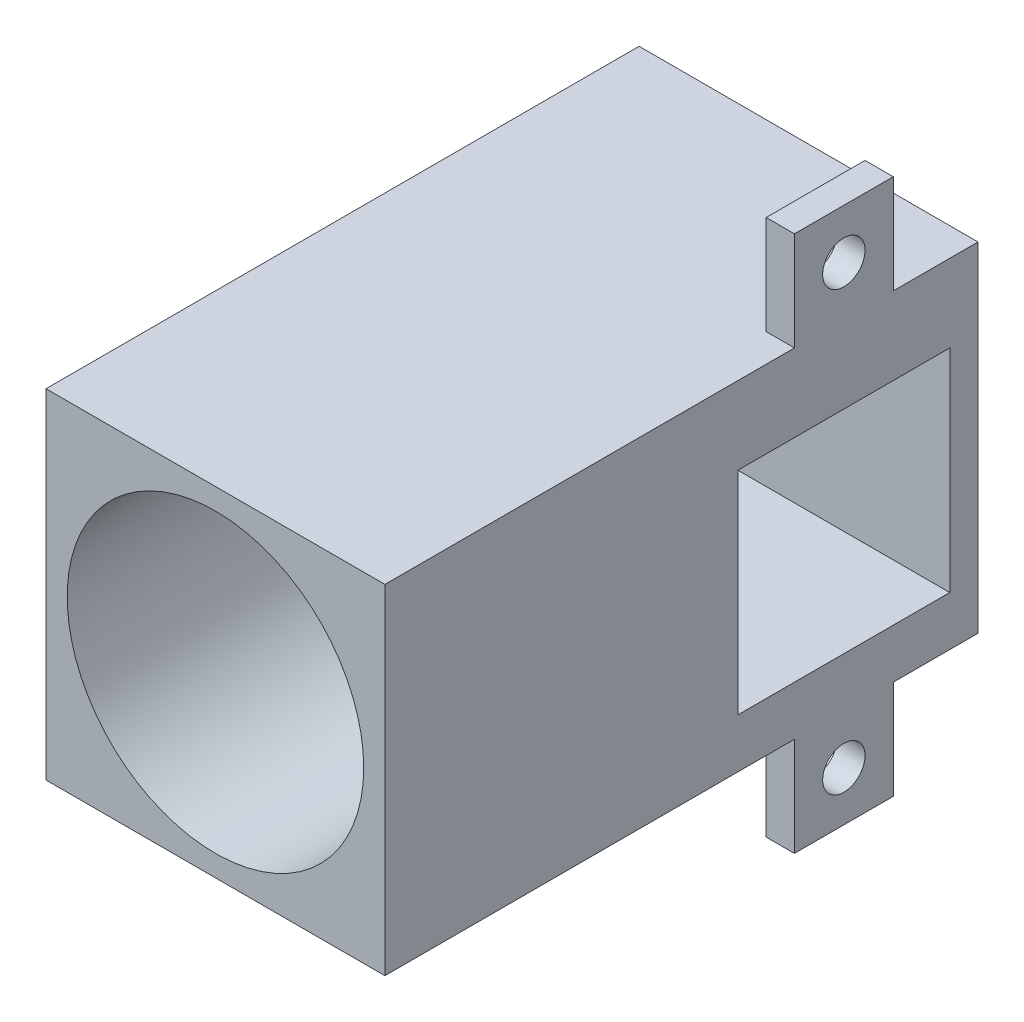
from build123d import *

# Parameters (mm, degrees)
SKETCH_1_W          = 24
SKETCH_1_H          = 24
EXTRUDE_1_DEPTH     = 42
SKETCH_3_R          = 10.5
CUT_EXTRUDE_1_DEPTH = 20
SKETCH_4_W          = 17
SKETCH_4_H          = 17
CUT_EXTRUDE_2_DEPTH = 20
CUT_EXTRUDE_5_DEPTH = 50.839743178
SKETCH_6_W          = 7
SKETCH_6_H          = 7
SKETCH_6_R          = 1.5
EXTRUDE_2_DEPTH     = 2


with BuildPart() as part:
    # Эскиз1 → Бобышка-Вытянуть1 (new body)
    with BuildSketch(Plane.XY):
        Rectangle(SKETCH_1_W, SKETCH_1_H)
    extrude(amount=EXTRUDE_1_DEPTH)

    # Эскиз3 → Вырез-Вытянуть1 (cut)
    with BuildSketch(Plane.XY.offset(42)):
        Circle(SKETCH_3_R)
    extrude(amount=-CUT_EXTRUDE_1_DEPTH, mode=Mode.SUBTRACT)

    # Эскиз4 → Вырез-Вытянуть2 (cut)
    with BuildSketch(Plane.XY.offset(22)):
        Rectangle(SKETCH_4_W, SKETCH_4_H)
    extrude(amount=-CUT_EXTRUDE_2_DEPTH, mode=Mode.SUBTRACT)

    # Эскиз5 → Вырез-Вытянуть5 (cut, through all)
    with BuildSketch(Plane(origin=(12, 0, 0), x_dir=(0, 0, -1), z_dir=(1, 0, 0))):
        Polygon((-2, -8.5), (-17, -8.5), (-17, 6.5), (-2, 6.5), (-2, 0), align=None)
    extrude(amount=-CUT_EXTRUDE_5_DEPTH, mode=Mode.SUBTRACT)

    # Эскиз6 → Бобышка-Вытянуть2 (add)
    # profile 1 of 2: a face of its own
    with BuildSketch(Plane(origin=(12, 0, 0), x_dir=(0, 0, -1), z_dir=(1, 0, 0))):
        with Locations((-9.5, 15.5)):
            Rectangle(SKETCH_6_W, SKETCH_6_H)
        with Locations((-9.5, 15.5)):
            Circle(SKETCH_6_R, mode=Mode.SUBTRACT)
    # profile 2 of 2: a face of its own
    with BuildSketch(Plane(origin=(12, 0, 0), x_dir=(0, 0, -1), z_dir=(1, 0, 0))):
        with Locations((-9.5, -15.5)):
            Rectangle(SKETCH_6_W, SKETCH_6_H)
        with Locations((-9.5, -15.5)):
            Circle(SKETCH_6_R, mode=Mode.SUBTRACT)
    extrude(amount=-EXTRUDE_2_DEPTH)


solid = part.part
